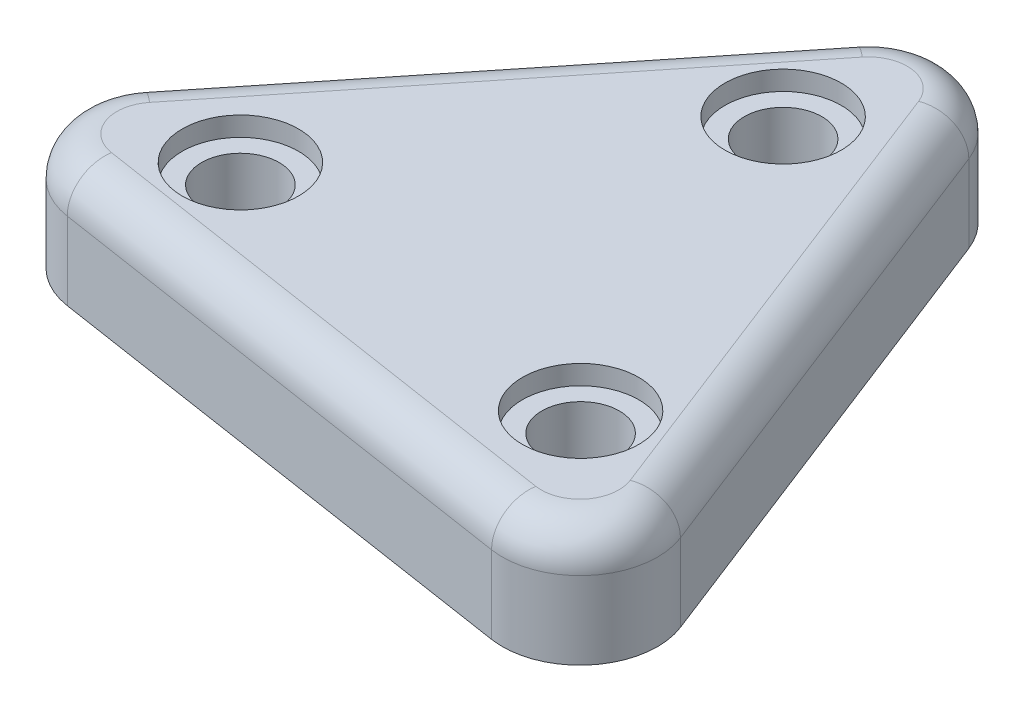
from build123d import *

# Parameters (mm, degrees)
SKETCH1_R           = 1
BOSS_EXTRUDE1_DEPTH = 3
FILLET1_R           = 2
FILLET2_R           = 1
SKETCH2_R           = 1.5
CUT_EXTRUDE1_DEPTH  = 0.5


with BuildPart() as part:
    # Sketch1 → Boss-Extrude1 (new body)
    with BuildSketch(Plane(origin=(0, 0, 0), x_dir=(1, 0, 0), z_dir=(0, 1, 0))):
        Polygon((1.750249519, 11.413586639), (-10.759580737, -4.191032773), (9.009331218, -7.222553866), align=None)
        with Locations((0.670392162, 5.734449205)):
            Circle(SKETCH1_R, mode=Mode.SUBTRACT)
        with Locations((4.630982607, -3.447801245)):
            Circle(SKETCH1_R, mode=Mode.SUBTRACT)
        with Locations((-5.301374769, -2.28664796)):
            Circle(SKETCH1_R, mode=Mode.SUBTRACT)
    extrude(amount=BOSS_EXTRUDE1_DEPTH)

    # Fillet1
    fillet1_edges = [part.edges().sort_by_distance(p)[0] for p in [
        (1.750249519, 1.5, -11.413586639),
        (9.009331218, 1.5, 7.222553866),
        (-10.759580737, 1.5, 4.191032773),
    ]]
    fillet(fillet1_edges, radius=FILLET1_R)

    # Fillet2
    fillet2_edges = [part.edges().sort_by_distance(p)[0] for p in [
        (-8.895966686, 3, 3.465124603),
        (-4.504665609, 3, -3.611276933),
        (1.44709741, 3, -9.436695443),
        (5.379790368, 3, -2.095516386),
        (7.448869277, 3, 5.97157084),
        (-0.875124759, 3, 5.706793319),
    ]]
    fillet(fillet2_edges, radius=FILLET2_R)

    # Sketch2 → Cut-Extrude1 (cut)
    with BuildSketch(Plane(origin=(0, 3, 0), x_dir=(1, 0, 0), z_dir=(0, 1, 0))):
        with Locations((0.670392162, 5.734449205)):
            Circle(SKETCH2_R)
        with Locations((-5.301374769, -2.28664796)):
            Circle(SKETCH2_R)
        with Locations((4.630982607, -3.447801245)):
            Circle(SKETCH2_R)
    extrude(amount=-CUT_EXTRUDE1_DEPTH, mode=Mode.SUBTRACT)


solid = part.part
